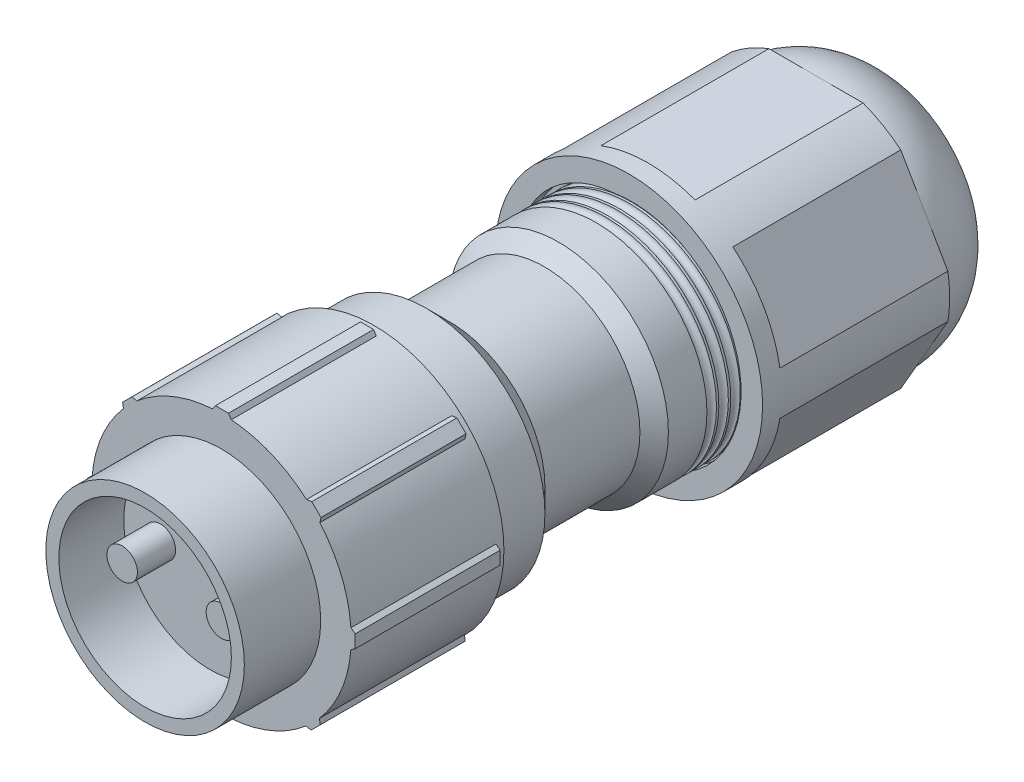
from build123d import *

# Parameters (mm, degrees)
SKETCH1_R           = 8.5
BOSS_EXTRUDE1_DEPTH = 10
SKETCH2_R           = 6.5
BOSS_EXTRUDE2_DEPTH = 5
BOSS_EXTRUDE3_START = 3.5
SKETCH4_R           = 7.195040541
BOSS_EXTRUDE3_DEPTH = 3.5
CUT_SWEEP2_PITCH    = 0.777777778
SKETCH7_R           = 8.75
BOSS_EXTRUDE5_DEPTH = 11.5
SKETCH10_R          = 3
CUT_EXTRUDE1_DEPTH  = 3
SKETCH11_R          = 5.65
CUT_EXTRUDE2_DEPTH  = 4.25
SKETCH12_R          = 1
BOSS_EXTRUDE6_DEPTH = 2.5
BOSS_EXTRUDE7_DEPTH = 9.5
CIRPATTERN2_COUNT   = 8
BOSS_EXTRUDE8_START = 0.75
BOSS_EXTRUDE8_DEPTH = 0.75
CUT_EXTRUDE3_DEPTH  = 11
CIRPATTERN3_COUNT   = 6
SKETCH17_R          = 1
BOSS_EXTRUDE9_DEPTH = 2.5


with BuildPart() as part:
    # Sketch1 → Boss-Extrude1 (new body)
    with BuildSketch(Plane.XY):
        Circle(SKETCH1_R)
    extrude(amount=-BOSS_EXTRUDE1_DEPTH)

    # Sketch2 → Boss-Extrude2 (add)
    with BuildSketch(Plane.XY):
        Circle(SKETCH2_R)
    extrude(amount=BOSS_EXTRUDE2_DEPTH)

    # Sketch3 → Revolve1 (revolve)
    with BuildSketch(Plane(origin=(0, 0, 0), x_dir=(0, 0, -1), z_dir=(1, 0, 0)), mode=Mode.PRIVATE) as revolve1_sk:
        Polygon((10, 7.766162729), (13.419300919, 7.766162729), (14.922254046, 6.263209602), (21.14447999, 6.263209602), (22.076310929, 7.195040541), (23.939972806, 7.195040541), (23.939972806, 0), (10, 0), align=None)
    revolve(revolve1_sk.sketch.rotate(Axis((0, 0, -23.939972806), (0, 0, 1)), 90), axis=Axis((0, 0, -23.939972806), (0, 0, 1)))

    # Sketch4 → Boss-Extrude3 (add)
    with BuildSketch(Plane(origin=(0, 0, -23.939972806), x_dir=(-1, 0, 0), z_dir=(0, 0, -1)).offset(BOSS_EXTRUDE3_START)):
        Circle(SKETCH4_R)
    extrude(amount=-BOSS_EXTRUDE3_DEPTH)

    # Cut-Sweep2: arcs per turn and ends read off the stored shape
    # Cut-Sweep2: the profile of Sketch6 screwed along a right-hand helix through 4 turns, 8 arcs to a turn; built about Z, then put on its axis
    cut_sweep2_z = Axis((0, 0, 0), (0, 0, 1))
    cut_sweep2_corners = [(-7.195040541, 0, -0.312225385), (-6.882815156, 0, 0), (-7.195040541, 0, 0.312225385), (-7.507265926, 0, 0)]
    with BuildLine(mode=Mode.PRIVATE) as cut_sweep2_profile:
        ThreePointArc((-7.195040541, 0, -0.312225385), (-6.974263854, 0, -0.220776687), (-6.882815156, 0, 0))
        ThreePointArc((-6.882815156, 0, 0), (-6.974263854, 0, 0.220776687), (-7.195040541, 0, 0.312225385))
        ThreePointArc((-7.195040541, 0, 0.312225385), (-7.415817228, 0, 0.220776687), (-7.507265926, 0, 0))
        ThreePointArc((-7.507265926, 0, 0), (-7.415817228, 0, -0.220776687), (-7.195040541, 0, -0.312225385))
    cut_sweep2_cap = Face(cut_sweep2_profile.wire())
    cut_sweep2_arcs = [((-7.195040541, 0, -0.312225385), (-6.882815156, 0, -0.312225385), (-6.882815156, 0, 0), (1, 0.7071067811865476, 1)), ((-6.882815156, 0, 0), (-6.882815156, 0, 0.312225385), (-7.195040541, 0, 0.312225385), (1, 0.7071067811865476, 1)), ((-7.195040541, 0, 0.312225385), (-7.507265926, 0, 0.312225385), (-7.507265926, 0, 0), (1, 0.7071067811865476, 1)), ((-7.507265926, 0, 0), (-7.507265926, 0, -0.312225385), (-7.195040541, 0, -0.312225385), (1, 0.7071067811865476, 1))]  # start, shoulder, end, weights
    cut_sweep2_turn_angles = [0, 22.5, 45, 67.5, 90, 112.5, 135, 157.5, 180, 202.5, 225, 247.5, 270, 292.5, 315, 337.5, 360]
    cut_sweep2_turn_weights = [1, 0.9238795325112867, 1, 0.9238795325112867, 1, 0.9238795325112867, 1, 0.9238795325112867, 1, 0.9238795325112867, 1, 0.9238795325112867, 1, 0.9238795325112867, 1, 0.9238795325112867, 1]
    cut_sweep2_turn_sides = [Face.make_bezier_surface([[Vector(p[j][0], p[j][1], 0).rotate(cut_sweep2_z, cut_sweep2_turn_angles[2 * i + k]) / cut_sweep2_turn_weights[2 * i + k] + Vector(0, 0, p[j][2] + CUT_SWEEP2_PITCH * cut_sweep2_turn_angles[2 * i + k] / 360) for k in range(3)] for j in range(3)], [[p[3][j] * cut_sweep2_turn_weights[2 * i + k] for k in range(3)] for j in range(3)]) for p in cut_sweep2_arcs for i in range(8)]
    cut_sweep2 = Plane(origin=(0, 0, -27.439972806), x_dir=(0, 1, 0), z_dir=(0, 0, 1)) * Solid(Shell([*[p.moved(Location((0, 0, CUT_SWEEP2_PITCH * i))) for i in range(4) for p in cut_sweep2_turn_sides], cut_sweep2_cap, cut_sweep2_cap.rotate(cut_sweep2_z, 1440).moved(Location((0, 0, CUT_SWEEP2_PITCH * 1440 / 360)))]))
    add(cut_sweep2, mode=Mode.SUBTRACT)

    # Sketch7 → Boss-Extrude5 (add)
    with BuildSketch(Plane(origin=(0, 0, -27.439972806), x_dir=(-1, 0, 0), z_dir=(0, 0, -1))):
        Circle(SKETCH7_R)
    extrude(amount=BOSS_EXTRUDE5_DEPTH)

    # Sketch8 → Revolve3 (revolve)
    with BuildSketch(Plane(origin=(0, 0, 0), x_dir=(0, 0, -1), z_dir=(1, 0, 0)), mode=Mode.PRIVATE) as revolve3_sk:
        with BuildLine():
            Line((38.939972806, 0), (38.939972806, 8.190865712))
            ThreePointArc((38.939972806, 8.190865712), (41.2665522, 7.781579121), (43.155119701, 6.362494914))
            Line((43.155119701, 6.362494914), (43.155119701, 0))
            Line((43.155119701, 0), (41.997846182, 0))
            Line((41.997846182, 0), (38.939972806, 0))
        make_face()
    revolve(revolve3_sk.sketch.rotate(Axis((0, 0, -41.997846182), (0, 0, 1)), 90), axis=Axis((0, 0, -41.997846182), (0, 0, 1)))

    # Sketch10 → Cut-Extrude1 (cut)
    with BuildSketch(Plane(origin=(0, 0, -43.155119701), x_dir=(-1, 0, 0), z_dir=(0, 0, -1))):
        Circle(SKETCH10_R)
    extrude(amount=-CUT_EXTRUDE1_DEPTH, mode=Mode.SUBTRACT)

    # Sketch11 → Cut-Extrude2 (cut)
    with BuildSketch(Plane.XY.offset(5)):
        Circle(SKETCH11_R)
    extrude(amount=-CUT_EXTRUDE2_DEPTH, mode=Mode.SUBTRACT)

    # Sketch12 → Boss-Extrude6 (add)
    with BuildSketch(Plane.XY.offset(0.75)):
        with Locations((-3.25, 0)):
            Circle(SKETCH12_R)
    extrude(amount=BOSS_EXTRUDE6_DEPTH)

    # Sketch14 → Boss-Extrude7 (add)
    with BuildSketch(Plane.XY):
        Polygon((-0.597109583, 8.479001129), (0.022890417, 8.471229408), (0.642890417, 8.47565289), (0.46177716, 8.75565289), (-0.388250759, 8.759001129), align=None)
    boss_extrude7 = extrude(amount=-BOSS_EXTRUDE7_DEPTH)

    # CirPattern2: Boss-Extrude7 ×8 about axis
    cirpattern2_axis = Axis((0, 0, 0), (0, 0, 1))
    for i in range(1, CIRPATTERN2_COUNT):
        add(boss_extrude7.rotate(cirpattern2_axis, i * 360 / CIRPATTERN2_COUNT))

    # Sketch15 → Boss-Extrude8 (add)
    with BuildSketch(Plane.XY.offset(-27.439972806).offset(BOSS_EXTRUDE8_START)):
        with BuildLine():
            ThreePointArc((-0.988548069, 8.693979107), (-6.527338493, 5.827207925), (-8.75, 0))
            ThreePointArc((-8.75, 0), (-6.29519092, -6.077258533), (-0.308155135, -8.744572054))
            ThreePointArc((-0.308155135, -8.744572054), (6.077258533, -6.29519092), (8.75, 0))
            ThreePointArc((8.75, 0), (5.827207925, 6.527338493), (-0.988548069, 8.693979107))
        make_face()
        with BuildLine():
            ThreePointArc((-0.988548069, 7.17422776), (-5.618268786, 4.889355548), (-7.276327064, 0))
            ThreePointArc((-7.276327064, 0), (-5.927223364, -4.357933307), (-2.21659335, -7.011777387))
            ThreePointArc((-2.21659335, -7.011777387), (5.102583825, -5.238548112), (7.08034461, 2.028030096))
            ThreePointArc((7.08034461, 2.028030096), (4.036675809, 6.154601637), (-0.988548069, 7.17422776))
        make_face(mode=Mode.SUBTRACT)
    extrude(amount=-BOSS_EXTRUDE8_DEPTH)

    # Sketch16 → Cut-Extrude3 (cut)
    with BuildSketch(Plane(origin=(0, 0, -38.939972806), x_dir=(-1, 0, 0), z_dir=(0, 0, -1))):
        Polygon((-0.029619759, 8.851786246), (-3.529619759, 8.851786246), (-3.529619759, 8.189592106), (3.470380241, 8.189592106), (3.470380241, 8.851786246), align=None)
    cut_extrude3 = extrude(amount=-CUT_EXTRUDE3_DEPTH, mode=Mode.SUBTRACT)

    # CirPattern3: Cut-Extrude3 ×6 about axis
    cirpattern3_axis = Axis((0, 0, 0), (0, 0, 1))
    for i in range(1, CIRPATTERN3_COUNT):
        add(cut_extrude3.rotate(cirpattern3_axis, i * 360 / CIRPATTERN3_COUNT), mode=Mode.SUBTRACT)

    # Sketch17 → Boss-Extrude9 (add)
    with BuildSketch(Plane.XY.offset(0.75)):
        with Locations((3.25, 0)):
            Circle(SKETCH17_R)
    extrude(amount=BOSS_EXTRUDE9_DEPTH)


solid = part.part
